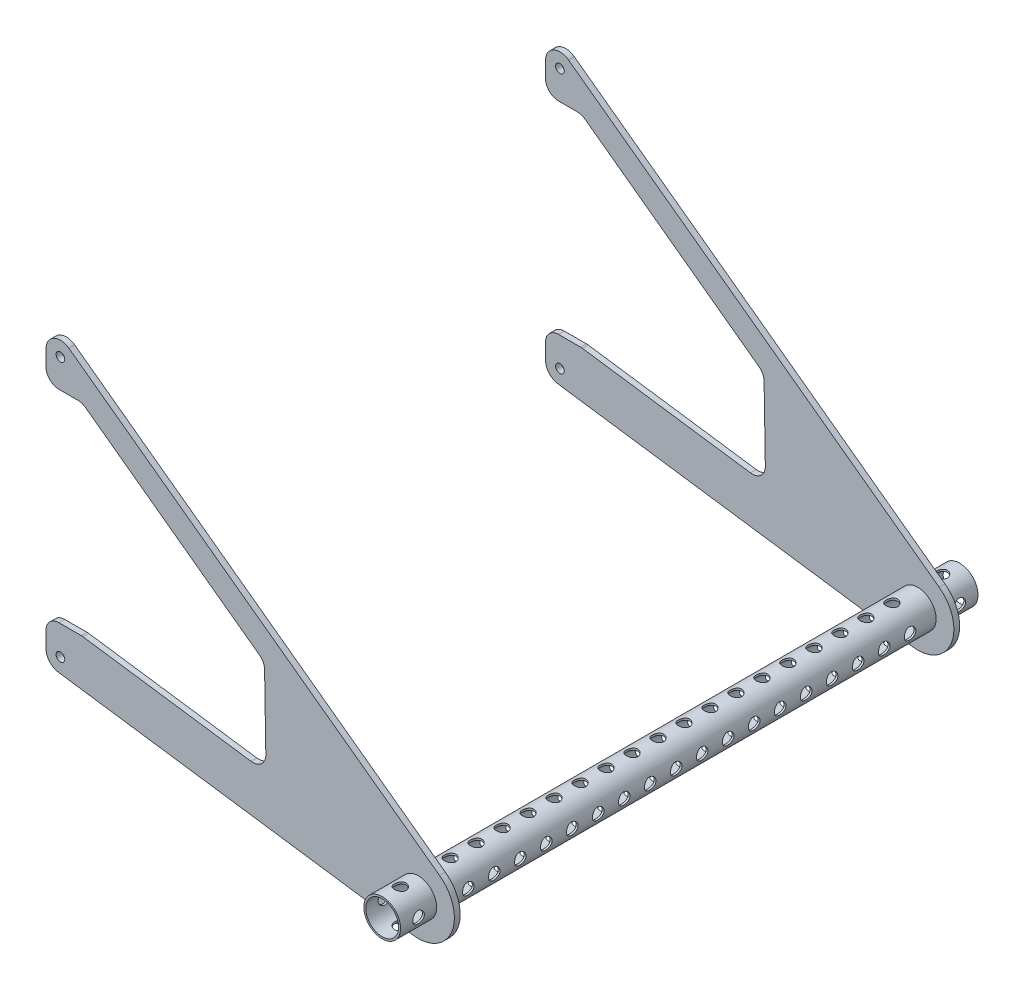
from build123d import *

# Parameters (mm, degrees)
BOSS_EXTRUDE1_DEPTH      = 200
BOSS_EXTRUDE1_DEPTH_BACK = 200
SKETCH1_R                = 12.7
SKETCH1_R_2              = 11.4
BOSS_EXTRUDE2_START      = 175
SKETCH2_R                = 3
SKETCH2_R_2              = 25
SKETCH2_R_3              = 12.7
BOSS_EXTRUDE2_DEPTH      = 4
SKETCH3_R                = 4
CUT_EXTRUDE1_DEPTH       = 389.076403758
SKETCH4_W                = 25
SKETCH4_H                = 140
CUT_EXTRUDE2_DEPTH       = 502.226790215
FILLET1_R                = 9
FILLET2_R                = 9


with BuildPart() as part:
    # Sketch1 → Boss-Extrude1 (new, two sides: drawn at the far end of the back side and taken through both)
    with BuildSketch(Plane.XY.offset(-BOSS_EXTRUDE1_DEPTH_BACK)):
        Circle(SKETCH1_R)
        Circle(SKETCH1_R_2, mode=Mode.SUBTRACT)
    extrude(amount=BOSS_EXTRUDE1_DEPTH + BOSS_EXTRUDE1_DEPTH_BACK)

    # Sketch3 → Cut-Extrude1 (cut, symmetric)
    with BuildSketch(Plane(origin=(0, 0, 0), x_dir=(1, 0, 0), z_dir=(0, 1, 0))):
        with Locations(Location((0, -187.5, 0), (0, 0, 270))):
            Circle(SKETCH3_R)
        with Locations(Location((0, -153, 0), (0, 0, 270))):
            Circle(SKETCH3_R)
        with Locations(Location((0, -135, 0), (0, 0, 270))):
            Circle(SKETCH3_R)
        with Locations(Location((0, -117, 0), (0, 0, 270))):
            Circle(SKETCH3_R)
        with Locations(Location((0, -99, 0), (0, 0, 270))):
            Circle(SKETCH3_R)
        with Locations(Location((0, -81, 0), (0, 0, 270))):
            Circle(SKETCH3_R)
        with Locations(Location((0, -63, 0), (0, 0, 270))):
            Circle(SKETCH3_R)
        with Locations(Location((0, -45, 0), (0, 0, 270))):
            Circle(SKETCH3_R)
        with Locations(Location((0, -27, 0), (0, 0, 270))):
            Circle(SKETCH3_R)
        with Locations(Location((0, -9, 0), (0, 0, 270))):
            Circle(SKETCH3_R)
    cut_extrude1 = extrude(amount=CUT_EXTRUDE1_DEPTH, both=True, mode=Mode.SUBTRACT)

    # Mirror2: Cut-Extrude1 across plane
    add(cut_extrude1.mirror(Plane.XY), mode=Mode.SUBTRACT)

    # CirPattern1: read off the stored shape, not the designer's step
    # CirPattern1: loft between two sections, ruled curve by curve
    cirpattern1_from = [
        Edge.make_three_point_arc((-12.700082991, 4, -9), (-12.700082991, 0, -5), (-12.700082991, -4, -9)),
        Edge.make_three_point_arc((-12.700082991, -4, -9), (-12.700082991, 0, -13), (-12.700082991, 4, -9)),
    ]
    cirpattern1_to = [
        Edge.make_three_point_arc((-10.674777388, 4, -9), (-10.674777388, 0, -5), (-10.674777388, -4, -9)),
        Edge.make_three_point_arc((-10.674777388, -4, -9), (-10.674777388, 0, -13), (-10.674777388, 4, -9)),
    ]
    cirpattern1 = Solid(Shell([*[Face.make_surface_from_curves(cirpattern1_from[k], cirpattern1_to[k]) for k in range(2)], Face(Wire(cirpattern1_from)), Face(Wire(cirpattern1_to))]))
    add(cirpattern1, mode=Mode.SUBTRACT)

    # CirPattern1 2: loft between two sections, ruled curve by curve
    cirpattern1_2_from = [
        Edge.make_three_point_arc((10.674895765, 0, -5), (10.674895765, -4, -9), (10.674895765, 0, -13)),
        Edge.make_three_point_arc((10.674895765, 0, -13), (10.674895765, 4, -9), (10.674895765, 0, -5)),
    ]
    cirpattern1_2_to = [
        Edge.make_three_point_arc((12.700001188, 0, -5), (12.700001188, -4, -9), (12.700001188, 0, -13)),
        Edge.make_three_point_arc((12.700001188, 0, -13), (12.700001188, 4, -9), (12.700001188, 0, -5)),
    ]
    cirpattern1_2 = Solid(Shell([*[Face.make_surface_from_curves(cirpattern1_2_from[k], cirpattern1_2_to[k]) for k in range(2)], Face(Wire(cirpattern1_2_from)), Face(Wire(cirpattern1_2_to))]))
    add(cirpattern1_2, mode=Mode.SUBTRACT)

    # CirPattern1 3: loft between two sections, ruled curve by curve
    cirpattern1_3_from = [
        Edge.make_three_point_arc((-12.700082991, 4, -27), (-12.700082991, 0, -23), (-12.700082991, -4, -27)),
        Edge.make_three_point_arc((-12.700082991, -4, -27), (-12.700082991, 0, -31), (-12.700082991, 4, -27)),
    ]
    cirpattern1_3_to = [
        Edge.make_three_point_arc((-10.674777388, 4, -27), (-10.674777388, 0, -23), (-10.674777388, -4, -27)),
        Edge.make_three_point_arc((-10.674777388, -4, -27), (-10.674777388, 0, -31), (-10.674777388, 4, -27)),
    ]
    cirpattern1_3 = Solid(Shell([*[Face.make_surface_from_curves(cirpattern1_3_from[k], cirpattern1_3_to[k]) for k in range(2)], Face(Wire(cirpattern1_3_from)), Face(Wire(cirpattern1_3_to))]))
    add(cirpattern1_3, mode=Mode.SUBTRACT)

    # CirPattern1 4: loft between two sections, ruled curve by curve
    cirpattern1_4_from = [
        Edge.make_three_point_arc((10.674895765, 0, -23), (10.674895765, -4, -27), (10.674895765, 0, -31)),
        Edge.make_three_point_arc((10.674895765, 0, -31), (10.674895765, 4, -27), (10.674895765, 0, -23)),
    ]
    cirpattern1_4_to = [
        Edge.make_three_point_arc((12.700001188, 0, -23), (12.700001188, -4, -27), (12.700001188, 0, -31)),
        Edge.make_three_point_arc((12.700001188, 0, -31), (12.700001188, 4, -27), (12.700001188, 0, -23)),
    ]
    cirpattern1_4 = Solid(Shell([*[Face.make_surface_from_curves(cirpattern1_4_from[k], cirpattern1_4_to[k]) for k in range(2)], Face(Wire(cirpattern1_4_from)), Face(Wire(cirpattern1_4_to))]))
    add(cirpattern1_4, mode=Mode.SUBTRACT)

    # CirPattern1 5: loft between two sections, ruled curve by curve
    cirpattern1_5_from = [
        Edge.make_three_point_arc((-12.700082991, 4, -45), (-12.700082991, 0, -41), (-12.700082991, -4, -45)),
        Edge.make_three_point_arc((-12.700082991, -4, -45), (-12.700082991, 0, -49), (-12.700082991, 4, -45)),
    ]
    cirpattern1_5_to = [
        Edge.make_three_point_arc((-10.674777388, 4, -45), (-10.674777388, 0, -41), (-10.674777388, -4, -45)),
        Edge.make_three_point_arc((-10.674777388, -4, -45), (-10.674777388, 0, -49), (-10.674777388, 4, -45)),
    ]
    cirpattern1_5 = Solid(Shell([*[Face.make_surface_from_curves(cirpattern1_5_from[k], cirpattern1_5_to[k]) for k in range(2)], Face(Wire(cirpattern1_5_from)), Face(Wire(cirpattern1_5_to))]))
    add(cirpattern1_5, mode=Mode.SUBTRACT)

    # CirPattern1 6: loft between two sections, ruled curve by curve
    cirpattern1_6_from = [
        Edge.make_three_point_arc((10.674895765, 0, -41), (10.674895765, -4, -45), (10.674895765, 0, -49)),
        Edge.make_three_point_arc((10.674895765, 0, -49), (10.674895765, 4, -45), (10.674895765, 0, -41)),
    ]
    cirpattern1_6_to = [
        Edge.make_three_point_arc((12.700001188, 0, -41), (12.700001188, -4, -45), (12.700001188, 0, -49)),
        Edge.make_three_point_arc((12.700001188, 0, -49), (12.700001188, 4, -45), (12.700001188, 0, -41)),
    ]
    cirpattern1_6 = Solid(Shell([*[Face.make_surface_from_curves(cirpattern1_6_from[k], cirpattern1_6_to[k]) for k in range(2)], Face(Wire(cirpattern1_6_from)), Face(Wire(cirpattern1_6_to))]))
    add(cirpattern1_6, mode=Mode.SUBTRACT)

    # CirPattern1 7: loft between two sections, ruled curve by curve
    cirpattern1_7_from = [
        Edge.make_three_point_arc((-12.700082991, 4, -63), (-12.700082991, 0, -59), (-12.700082991, -4, -63)),
        Edge.make_three_point_arc((-12.700082991, -4, -63), (-12.700082991, 0, -67), (-12.700082991, 4, -63)),
    ]
    cirpattern1_7_to = [
        Edge.make_three_point_arc((-10.674777388, 4, -63), (-10.674777388, 0, -59), (-10.674777388, -4, -63)),
        Edge.make_three_point_arc((-10.674777388, -4, -63), (-10.674777388, 0, -67), (-10.674777388, 4, -63)),
    ]
    cirpattern1_7 = Solid(Shell([*[Face.make_surface_from_curves(cirpattern1_7_from[k], cirpattern1_7_to[k]) for k in range(2)], Face(Wire(cirpattern1_7_from)), Face(Wire(cirpattern1_7_to))]))
    add(cirpattern1_7, mode=Mode.SUBTRACT)

    # CirPattern1 8: loft between two sections, ruled curve by curve
    cirpattern1_8_from = [
        Edge.make_three_point_arc((10.674895765, 0, -59), (10.674895765, -4, -63), (10.674895765, 0, -67)),
        Edge.make_three_point_arc((10.674895765, 0, -67), (10.674895765, 4, -63), (10.674895765, 0, -59)),
    ]
    cirpattern1_8_to = [
        Edge.make_three_point_arc((12.700001188, 0, -59), (12.700001188, -4, -63), (12.700001188, 0, -67)),
        Edge.make_three_point_arc((12.700001188, 0, -67), (12.700001188, 4, -63), (12.700001188, 0, -59)),
    ]
    cirpattern1_8 = Solid(Shell([*[Face.make_surface_from_curves(cirpattern1_8_from[k], cirpattern1_8_to[k]) for k in range(2)], Face(Wire(cirpattern1_8_from)), Face(Wire(cirpattern1_8_to))]))
    add(cirpattern1_8, mode=Mode.SUBTRACT)

    # CirPattern1 9: loft between two sections, ruled curve by curve
    cirpattern1_9_from = [
        Edge.make_three_point_arc((-12.700082991, 4, -81), (-12.700082991, 0, -77), (-12.700082991, -4, -81)),
        Edge.make_three_point_arc((-12.700082991, -4, -81), (-12.700082991, 0, -85), (-12.700082991, 4, -81)),
    ]
    cirpattern1_9_to = [
        Edge.make_three_point_arc((-10.674777388, 4, -81), (-10.674777388, 0, -77), (-10.674777388, -4, -81)),
        Edge.make_three_point_arc((-10.674777388, -4, -81), (-10.674777388, 0, -85), (-10.674777388, 4, -81)),
    ]
    cirpattern1_9 = Solid(Shell([*[Face.make_surface_from_curves(cirpattern1_9_from[k], cirpattern1_9_to[k]) for k in range(2)], Face(Wire(cirpattern1_9_from)), Face(Wire(cirpattern1_9_to))]))
    add(cirpattern1_9, mode=Mode.SUBTRACT)

    # CirPattern1 10: loft between two sections, ruled curve by curve
    cirpattern1_10_from = [
        Edge.make_three_point_arc((10.674895765, 0, -77), (10.674895765, -4, -81), (10.674895765, 0, -85)),
        Edge.make_three_point_arc((10.674895765, 0, -85), (10.674895765, 4, -81), (10.674895765, 0, -77)),
    ]
    cirpattern1_10_to = [
        Edge.make_three_point_arc((12.700001188, 0, -77), (12.700001188, -4, -81), (12.700001188, 0, -85)),
        Edge.make_three_point_arc((12.700001188, 0, -85), (12.700001188, 4, -81), (12.700001188, 0, -77)),
    ]
    cirpattern1_10 = Solid(Shell([*[Face.make_surface_from_curves(cirpattern1_10_from[k], cirpattern1_10_to[k]) for k in range(2)], Face(Wire(cirpattern1_10_from)), Face(Wire(cirpattern1_10_to))]))
    add(cirpattern1_10, mode=Mode.SUBTRACT)

    # CirPattern1 11: loft between two sections, ruled curve by curve
    cirpattern1_11_from = [
        Edge.make_three_point_arc((-12.700082991, 4, -99), (-12.700082991, 0, -95), (-12.700082991, -4, -99)),
        Edge.make_three_point_arc((-12.700082991, -4, -99), (-12.700082991, 0, -103), (-12.700082991, 4, -99)),
    ]
    cirpattern1_11_to = [
        Edge.make_three_point_arc((-10.674777388, 4, -99), (-10.674777388, 0, -95), (-10.674777388, -4, -99)),
        Edge.make_three_point_arc((-10.674777388, -4, -99), (-10.674777388, 0, -103), (-10.674777388, 4, -99)),
    ]
    cirpattern1_11 = Solid(Shell([*[Face.make_surface_from_curves(cirpattern1_11_from[k], cirpattern1_11_to[k]) for k in range(2)], Face(Wire(cirpattern1_11_from)), Face(Wire(cirpattern1_11_to))]))
    add(cirpattern1_11, mode=Mode.SUBTRACT)

    # CirPattern1 12: loft between two sections, ruled curve by curve
    cirpattern1_12_from = [
        Edge.make_three_point_arc((10.674895765, 0, -95), (10.674895765, -4, -99), (10.674895765, 0, -103)),
        Edge.make_three_point_arc((10.674895765, 0, -103), (10.674895765, 4, -99), (10.674895765, 0, -95)),
    ]
    cirpattern1_12_to = [
        Edge.make_three_point_arc((12.700001188, 0, -95), (12.700001188, -4, -99), (12.700001188, 0, -103)),
        Edge.make_three_point_arc((12.700001188, 0, -103), (12.700001188, 4, -99), (12.700001188, 0, -95)),
    ]
    cirpattern1_12 = Solid(Shell([*[Face.make_surface_from_curves(cirpattern1_12_from[k], cirpattern1_12_to[k]) for k in range(2)], Face(Wire(cirpattern1_12_from)), Face(Wire(cirpattern1_12_to))]))
    add(cirpattern1_12, mode=Mode.SUBTRACT)

    # CirPattern1 13: loft between two sections, ruled curve by curve
    cirpattern1_13_from = [
        Edge.make_three_point_arc((-12.700082991, 4, -117), (-12.700082991, 0, -113), (-12.700082991, -4, -117)),
        Edge.make_three_point_arc((-12.700082991, -4, -117), (-12.700082991, 0, -121), (-12.700082991, 4, -117)),
    ]
    cirpattern1_13_to = [
        Edge.make_three_point_arc((-10.674777388, 4, -117), (-10.674777388, 0, -113), (-10.674777388, -4, -117)),
        Edge.make_three_point_arc((-10.674777388, -4, -117), (-10.674777388, 0, -121), (-10.674777388, 4, -117)),
    ]
    cirpattern1_13 = Solid(Shell([*[Face.make_surface_from_curves(cirpattern1_13_from[k], cirpattern1_13_to[k]) for k in range(2)], Face(Wire(cirpattern1_13_from)), Face(Wire(cirpattern1_13_to))]))
    add(cirpattern1_13, mode=Mode.SUBTRACT)

    # CirPattern1 14: loft between two sections, ruled curve by curve
    cirpattern1_14_from = [
        Edge.make_three_point_arc((10.674895765, 0, -113), (10.674895765, -4, -117), (10.674895765, 0, -121)),
        Edge.make_three_point_arc((10.674895765, 0, -121), (10.674895765, 4, -117), (10.674895765, 0, -113)),
    ]
    cirpattern1_14_to = [
        Edge.make_three_point_arc((12.700001188, 0, -113), (12.700001188, -4, -117), (12.700001188, 0, -121)),
        Edge.make_three_point_arc((12.700001188, 0, -121), (12.700001188, 4, -117), (12.700001188, 0, -113)),
    ]
    cirpattern1_14 = Solid(Shell([*[Face.make_surface_from_curves(cirpattern1_14_from[k], cirpattern1_14_to[k]) for k in range(2)], Face(Wire(cirpattern1_14_from)), Face(Wire(cirpattern1_14_to))]))
    add(cirpattern1_14, mode=Mode.SUBTRACT)

    # CirPattern1 15: loft between two sections, ruled curve by curve
    cirpattern1_15_from = [
        Edge.make_three_point_arc((-12.700082991, 4, -135), (-12.700082991, 0, -131), (-12.700082991, -4, -135)),
        Edge.make_three_point_arc((-12.700082991, -4, -135), (-12.700082991, 0, -139), (-12.700082991, 4, -135)),
    ]
    cirpattern1_15_to = [
        Edge.make_three_point_arc((-10.674777388, 4, -135), (-10.674777388, 0, -131), (-10.674777388, -4, -135)),
        Edge.make_three_point_arc((-10.674777388, -4, -135), (-10.674777388, 0, -139), (-10.674777388, 4, -135)),
    ]
    cirpattern1_15 = Solid(Shell([*[Face.make_surface_from_curves(cirpattern1_15_from[k], cirpattern1_15_to[k]) for k in range(2)], Face(Wire(cirpattern1_15_from)), Face(Wire(cirpattern1_15_to))]))
    add(cirpattern1_15, mode=Mode.SUBTRACT)

    # CirPattern1 16: loft between two sections, ruled curve by curve
    cirpattern1_16_from = [
        Edge.make_three_point_arc((10.674895765, 0, -131), (10.674895765, -4, -135), (10.674895765, 0, -139)),
        Edge.make_three_point_arc((10.674895765, 0, -139), (10.674895765, 4, -135), (10.674895765, 0, -131)),
    ]
    cirpattern1_16_to = [
        Edge.make_three_point_arc((12.700001188, 0, -131), (12.700001188, -4, -135), (12.700001188, 0, -139)),
        Edge.make_three_point_arc((12.700001188, 0, -139), (12.700001188, 4, -135), (12.700001188, 0, -131)),
    ]
    cirpattern1_16 = Solid(Shell([*[Face.make_surface_from_curves(cirpattern1_16_from[k], cirpattern1_16_to[k]) for k in range(2)], Face(Wire(cirpattern1_16_from)), Face(Wire(cirpattern1_16_to))]))
    add(cirpattern1_16, mode=Mode.SUBTRACT)

    # CirPattern1 17: loft between two sections, ruled curve by curve
    cirpattern1_17_from = [
        Edge.make_three_point_arc((-12.700082991, 4, -153), (-12.700082991, 0, -149), (-12.700082991, -4, -153)),
        Edge.make_three_point_arc((-12.700082991, -4, -153), (-12.700082991, 0, -157), (-12.700082991, 4, -153)),
    ]
    cirpattern1_17_to = [
        Edge.make_three_point_arc((-10.674777388, 4, -153), (-10.674777388, 0, -149), (-10.674777388, -4, -153)),
        Edge.make_three_point_arc((-10.674777388, -4, -153), (-10.674777388, 0, -157), (-10.674777388, 4, -153)),
    ]
    cirpattern1_17 = Solid(Shell([*[Face.make_surface_from_curves(cirpattern1_17_from[k], cirpattern1_17_to[k]) for k in range(2)], Face(Wire(cirpattern1_17_from)), Face(Wire(cirpattern1_17_to))]))
    add(cirpattern1_17, mode=Mode.SUBTRACT)

    # CirPattern1 18: loft between two sections, ruled curve by curve
    cirpattern1_18_from = [
        Edge.make_three_point_arc((10.674895765, 0, -149), (10.674895765, -4, -153), (10.674895765, 0, -157)),
        Edge.make_three_point_arc((10.674895765, 0, -157), (10.674895765, 4, -153), (10.674895765, 0, -149)),
    ]
    cirpattern1_18_to = [
        Edge.make_three_point_arc((12.700001188, 0, -149), (12.700001188, -4, -153), (12.700001188, 0, -157)),
        Edge.make_three_point_arc((12.700001188, 0, -157), (12.700001188, 4, -153), (12.700001188, 0, -149)),
    ]
    cirpattern1_18 = Solid(Shell([*[Face.make_surface_from_curves(cirpattern1_18_from[k], cirpattern1_18_to[k]) for k in range(2)], Face(Wire(cirpattern1_18_from)), Face(Wire(cirpattern1_18_to))]))
    add(cirpattern1_18, mode=Mode.SUBTRACT)

    # CirPattern1 19: loft between two sections, ruled curve by curve
    cirpattern1_19_from = [
        Edge.make_three_point_arc((-12.700082991, 4, -187.5), (-12.700082991, 0, -183.5), (-12.700082991, -4, -187.5)),
        Edge.make_three_point_arc((-12.700082991, -4, -187.5), (-12.700082991, 0, -191.5), (-12.700082991, 4, -187.5)),
    ]
    cirpattern1_19_to = [
        Edge.make_three_point_arc((-10.674777388, 4, -187.5), (-10.674777388, 0, -183.5), (-10.674777388, -4, -187.5)),
        Edge.make_three_point_arc((-10.674777388, -4, -187.5), (-10.674777388, 0, -191.5), (-10.674777388, 4, -187.5)),
    ]
    cirpattern1_19 = Solid(Shell([*[Face.make_surface_from_curves(cirpattern1_19_from[k], cirpattern1_19_to[k]) for k in range(2)], Face(Wire(cirpattern1_19_from)), Face(Wire(cirpattern1_19_to))]))
    add(cirpattern1_19, mode=Mode.SUBTRACT)

    # CirPattern1 20: loft between two sections, ruled curve by curve
    cirpattern1_20_from = [
        Edge.make_three_point_arc((10.674895765, 0, -183.5), (10.674895765, -4, -187.5), (10.674895765, 0, -191.5)),
        Edge.make_three_point_arc((10.674895765, 0, -191.5), (10.674895765, 4, -187.5), (10.674895765, 0, -183.5)),
    ]
    cirpattern1_20_to = [
        Edge.make_three_point_arc((12.700001188, 0, -183.5), (12.700001188, -4, -187.5), (12.700001188, 0, -191.5)),
        Edge.make_three_point_arc((12.700001188, 0, -191.5), (12.700001188, 4, -187.5), (12.700001188, 0, -183.5)),
    ]
    cirpattern1_20 = Solid(Shell([*[Face.make_surface_from_curves(cirpattern1_20_from[k], cirpattern1_20_to[k]) for k in range(2)], Face(Wire(cirpattern1_20_from)), Face(Wire(cirpattern1_20_to))]))
    add(cirpattern1_20, mode=Mode.SUBTRACT)

    # CirPattern1 21: loft between two sections, ruled curve by curve
    cirpattern1_21_from = [
        Edge.make_three_point_arc((10.674895765, 0, 183.5), (10.674895765, 4, 187.5), (10.674895765, 0, 191.5)),
        Edge.make_three_point_arc((10.674895765, 0, 191.5), (10.674895765, -4, 187.5), (10.674895765, 0, 183.5)),
    ]
    cirpattern1_21_to = [
        Edge.make_three_point_arc((12.700001188, 0, 183.5), (12.700001188, 4, 187.5), (12.700001188, 0, 191.5)),
        Edge.make_three_point_arc((12.700001188, 0, 191.5), (12.700001188, -4, 187.5), (12.700001188, 0, 183.5)),
    ]
    cirpattern1_21 = Solid(Shell([*[Face.make_surface_from_curves(cirpattern1_21_from[k], cirpattern1_21_to[k]) for k in range(2)], Face(Wire(cirpattern1_21_from)), Face(Wire(cirpattern1_21_to))]))
    add(cirpattern1_21, mode=Mode.SUBTRACT)

    # CirPattern1 22: loft between two sections, ruled curve by curve
    cirpattern1_22_from = [
        Edge.make_three_point_arc((-12.700356377, 4, 187.5), (-12.700356377, 0, 191.5), (-12.700356377, -4, 187.5)),
        Edge.make_three_point_arc((-12.700356377, -4, 187.5), (-12.700356377, 0, 183.5), (-12.700356377, 4, 187.5)),
    ]
    cirpattern1_22_to = [
        Edge.make_three_point_arc((-10.674777388, 4, 187.5), (-10.674777388, 0, 191.5), (-10.674777388, -4, 187.5)),
        Edge.make_three_point_arc((-10.674777388, -4, 187.5), (-10.674777388, 0, 183.5), (-10.674777388, 4, 187.5)),
    ]
    cirpattern1_22 = Solid(Shell([*[Face.make_surface_from_curves(cirpattern1_22_from[k], cirpattern1_22_to[k]) for k in range(2)], Face(Wire(cirpattern1_22_from)), Face(Wire(cirpattern1_22_to))]))
    add(cirpattern1_22, mode=Mode.SUBTRACT)

    # CirPattern1 23: loft between two sections, ruled curve by curve
    cirpattern1_23_from = [
        Edge.make_three_point_arc((10.674895765, 0, 149), (10.674895765, 4, 153), (10.674895765, 0, 157)),
        Edge.make_three_point_arc((10.674895765, 0, 157), (10.674895765, -4, 153), (10.674895765, 0, 149)),
    ]
    cirpattern1_23_to = [
        Edge.make_three_point_arc((12.700001188, 0, 149), (12.700001188, 4, 153), (12.700001188, 0, 157)),
        Edge.make_three_point_arc((12.700001188, 0, 157), (12.700001188, -4, 153), (12.700001188, 0, 149)),
    ]
    cirpattern1_23 = Solid(Shell([*[Face.make_surface_from_curves(cirpattern1_23_from[k], cirpattern1_23_to[k]) for k in range(2)], Face(Wire(cirpattern1_23_from)), Face(Wire(cirpattern1_23_to))]))
    add(cirpattern1_23, mode=Mode.SUBTRACT)

    # CirPattern1 24: loft between two sections, ruled curve by curve
    cirpattern1_24_from = [
        Edge.make_three_point_arc((-12.700356377, 4, 153), (-12.700356377, 0, 157), (-12.700356377, -4, 153)),
        Edge.make_three_point_arc((-12.700356377, -4, 153), (-12.700356377, 0, 149), (-12.700356377, 4, 153)),
    ]
    cirpattern1_24_to = [
        Edge.make_three_point_arc((-10.674777388, 4, 153), (-10.674777388, 0, 157), (-10.674777388, -4, 153)),
        Edge.make_three_point_arc((-10.674777388, -4, 153), (-10.674777388, 0, 149), (-10.674777388, 4, 153)),
    ]
    cirpattern1_24 = Solid(Shell([*[Face.make_surface_from_curves(cirpattern1_24_from[k], cirpattern1_24_to[k]) for k in range(2)], Face(Wire(cirpattern1_24_from)), Face(Wire(cirpattern1_24_to))]))
    add(cirpattern1_24, mode=Mode.SUBTRACT)

    # CirPattern1 25: loft between two sections, ruled curve by curve
    cirpattern1_25_from = [
        Edge.make_three_point_arc((10.674895765, 0, 131), (10.674895765, 4, 135), (10.674895765, 0, 139)),
        Edge.make_three_point_arc((10.674895765, 0, 139), (10.674895765, -4, 135), (10.674895765, 0, 131)),
    ]
    cirpattern1_25_to = [
        Edge.make_three_point_arc((12.700001188, 0, 131), (12.700001188, 4, 135), (12.700001188, 0, 139)),
        Edge.make_three_point_arc((12.700001188, 0, 139), (12.700001188, -4, 135), (12.700001188, 0, 131)),
    ]
    cirpattern1_25 = Solid(Shell([*[Face.make_surface_from_curves(cirpattern1_25_from[k], cirpattern1_25_to[k]) for k in range(2)], Face(Wire(cirpattern1_25_from)), Face(Wire(cirpattern1_25_to))]))
    add(cirpattern1_25, mode=Mode.SUBTRACT)

    # CirPattern1 26: loft between two sections, ruled curve by curve
    cirpattern1_26_from = [
        Edge.make_three_point_arc((-12.700356377, 4, 135), (-12.700356377, 0, 139), (-12.700356377, -4, 135)),
        Edge.make_three_point_arc((-12.700356377, -4, 135), (-12.700356377, 0, 131), (-12.700356377, 4, 135)),
    ]
    cirpattern1_26_to = [
        Edge.make_three_point_arc((-10.674777388, 4, 135), (-10.674777388, 0, 139), (-10.674777388, -4, 135)),
        Edge.make_three_point_arc((-10.674777388, -4, 135), (-10.674777388, 0, 131), (-10.674777388, 4, 135)),
    ]
    cirpattern1_26 = Solid(Shell([*[Face.make_surface_from_curves(cirpattern1_26_from[k], cirpattern1_26_to[k]) for k in range(2)], Face(Wire(cirpattern1_26_from)), Face(Wire(cirpattern1_26_to))]))
    add(cirpattern1_26, mode=Mode.SUBTRACT)

    # CirPattern1 27: loft between two sections, ruled curve by curve
    cirpattern1_27_from = [
        Edge.make_three_point_arc((10.674895765, 0, 113), (10.674895765, 4, 117), (10.674895765, 0, 121)),
        Edge.make_three_point_arc((10.674895765, 0, 121), (10.674895765, -4, 117), (10.674895765, 0, 113)),
    ]
    cirpattern1_27_to = [
        Edge.make_three_point_arc((12.700001188, 0, 113), (12.700001188, 4, 117), (12.700001188, 0, 121)),
        Edge.make_three_point_arc((12.700001188, 0, 121), (12.700001188, -4, 117), (12.700001188, 0, 113)),
    ]
    cirpattern1_27 = Solid(Shell([*[Face.make_surface_from_curves(cirpattern1_27_from[k], cirpattern1_27_to[k]) for k in range(2)], Face(Wire(cirpattern1_27_from)), Face(Wire(cirpattern1_27_to))]))
    add(cirpattern1_27, mode=Mode.SUBTRACT)

    # CirPattern1 28: loft between two sections, ruled curve by curve
    cirpattern1_28_from = [
        Edge.make_three_point_arc((-12.700356377, 4, 117), (-12.700356377, 0, 121), (-12.700356377, -4, 117)),
        Edge.make_three_point_arc((-12.700356377, -4, 117), (-12.700356377, 0, 113), (-12.700356377, 4, 117)),
    ]
    cirpattern1_28_to = [
        Edge.make_three_point_arc((-10.674777388, 4, 117), (-10.674777388, 0, 121), (-10.674777388, -4, 117)),
        Edge.make_three_point_arc((-10.674777388, -4, 117), (-10.674777388, 0, 113), (-10.674777388, 4, 117)),
    ]
    cirpattern1_28 = Solid(Shell([*[Face.make_surface_from_curves(cirpattern1_28_from[k], cirpattern1_28_to[k]) for k in range(2)], Face(Wire(cirpattern1_28_from)), Face(Wire(cirpattern1_28_to))]))
    add(cirpattern1_28, mode=Mode.SUBTRACT)

    # CirPattern1 29: loft between two sections, ruled curve by curve
    cirpattern1_29_from = [
        Edge.make_three_point_arc((10.674895765, 0, 95), (10.674895765, 4, 99), (10.674895765, 0, 103)),
        Edge.make_three_point_arc((10.674895765, 0, 103), (10.674895765, -4, 99), (10.674895765, 0, 95)),
    ]
    cirpattern1_29_to = [
        Edge.make_three_point_arc((12.700001188, 0, 95), (12.700001188, 4, 99), (12.700001188, 0, 103)),
        Edge.make_three_point_arc((12.700001188, 0, 103), (12.700001188, -4, 99), (12.700001188, 0, 95)),
    ]
    cirpattern1_29 = Solid(Shell([*[Face.make_surface_from_curves(cirpattern1_29_from[k], cirpattern1_29_to[k]) for k in range(2)], Face(Wire(cirpattern1_29_from)), Face(Wire(cirpattern1_29_to))]))
    add(cirpattern1_29, mode=Mode.SUBTRACT)

    # CirPattern1 30: loft between two sections, ruled curve by curve
    cirpattern1_30_from = [
        Edge.make_three_point_arc((-12.700356377, 4, 99), (-12.700356377, 0, 103), (-12.700356377, -4, 99)),
        Edge.make_three_point_arc((-12.700356377, -4, 99), (-12.700356377, 0, 95), (-12.700356377, 4, 99)),
    ]
    cirpattern1_30_to = [
        Edge.make_three_point_arc((-10.674777388, 4, 99), (-10.674777388, 0, 103), (-10.674777388, -4, 99)),
        Edge.make_three_point_arc((-10.674777388, -4, 99), (-10.674777388, 0, 95), (-10.674777388, 4, 99)),
    ]
    cirpattern1_30 = Solid(Shell([*[Face.make_surface_from_curves(cirpattern1_30_from[k], cirpattern1_30_to[k]) for k in range(2)], Face(Wire(cirpattern1_30_from)), Face(Wire(cirpattern1_30_to))]))
    add(cirpattern1_30, mode=Mode.SUBTRACT)

    # CirPattern1 31: loft between two sections, ruled curve by curve
    cirpattern1_31_from = [
        Edge.make_three_point_arc((10.674895765, 0, 77), (10.674895765, 4, 81), (10.674895765, 0, 85)),
        Edge.make_three_point_arc((10.674895765, 0, 85), (10.674895765, -4, 81), (10.674895765, 0, 77)),
    ]
    cirpattern1_31_to = [
        Edge.make_three_point_arc((12.700001188, 0, 77), (12.700001188, 4, 81), (12.700001188, 0, 85)),
        Edge.make_three_point_arc((12.700001188, 0, 85), (12.700001188, -4, 81), (12.700001188, 0, 77)),
    ]
    cirpattern1_31 = Solid(Shell([*[Face.make_surface_from_curves(cirpattern1_31_from[k], cirpattern1_31_to[k]) for k in range(2)], Face(Wire(cirpattern1_31_from)), Face(Wire(cirpattern1_31_to))]))
    add(cirpattern1_31, mode=Mode.SUBTRACT)

    # CirPattern1 32: loft between two sections, ruled curve by curve
    cirpattern1_32_from = [
        Edge.make_three_point_arc((-12.700356377, 4, 81), (-12.700356377, 0, 85), (-12.700356377, -4, 81)),
        Edge.make_three_point_arc((-12.700356377, -4, 81), (-12.700356377, 0, 77), (-12.700356377, 4, 81)),
    ]
    cirpattern1_32_to = [
        Edge.make_three_point_arc((-10.674777388, 4, 81), (-10.674777388, 0, 85), (-10.674777388, -4, 81)),
        Edge.make_three_point_arc((-10.674777388, -4, 81), (-10.674777388, 0, 77), (-10.674777388, 4, 81)),
    ]
    cirpattern1_32 = Solid(Shell([*[Face.make_surface_from_curves(cirpattern1_32_from[k], cirpattern1_32_to[k]) for k in range(2)], Face(Wire(cirpattern1_32_from)), Face(Wire(cirpattern1_32_to))]))
    add(cirpattern1_32, mode=Mode.SUBTRACT)

    # CirPattern1 33: loft between two sections, ruled curve by curve
    cirpattern1_33_from = [
        Edge.make_three_point_arc((10.674895765, 0, 59), (10.674895765, 4, 63), (10.674895765, 0, 67)),
        Edge.make_three_point_arc((10.674895765, 0, 67), (10.674895765, -4, 63), (10.674895765, 0, 59)),
    ]
    cirpattern1_33_to = [
        Edge.make_three_point_arc((12.700001188, 0, 59), (12.700001188, 4, 63), (12.700001188, 0, 67)),
        Edge.make_three_point_arc((12.700001188, 0, 67), (12.700001188, -4, 63), (12.700001188, 0, 59)),
    ]
    cirpattern1_33 = Solid(Shell([*[Face.make_surface_from_curves(cirpattern1_33_from[k], cirpattern1_33_to[k]) for k in range(2)], Face(Wire(cirpattern1_33_from)), Face(Wire(cirpattern1_33_to))]))
    add(cirpattern1_33, mode=Mode.SUBTRACT)

    # CirPattern1 34: loft between two sections, ruled curve by curve
    cirpattern1_34_from = [
        Edge.make_three_point_arc((-12.700356377, 4, 63), (-12.700356377, 0, 67), (-12.700356377, -4, 63)),
        Edge.make_three_point_arc((-12.700356377, -4, 63), (-12.700356377, 0, 59), (-12.700356377, 4, 63)),
    ]
    cirpattern1_34_to = [
        Edge.make_three_point_arc((-10.674777388, 4, 63), (-10.674777388, 0, 67), (-10.674777388, -4, 63)),
        Edge.make_three_point_arc((-10.674777388, -4, 63), (-10.674777388, 0, 59), (-10.674777388, 4, 63)),
    ]
    cirpattern1_34 = Solid(Shell([*[Face.make_surface_from_curves(cirpattern1_34_from[k], cirpattern1_34_to[k]) for k in range(2)], Face(Wire(cirpattern1_34_from)), Face(Wire(cirpattern1_34_to))]))
    add(cirpattern1_34, mode=Mode.SUBTRACT)

    # CirPattern1 35: loft between two sections, ruled curve by curve
    cirpattern1_35_from = [
        Edge.make_three_point_arc((10.674895765, 0, 41), (10.674895765, 4, 45), (10.674895765, 0, 49)),
        Edge.make_three_point_arc((10.674895765, 0, 49), (10.674895765, -4, 45), (10.674895765, 0, 41)),
    ]
    cirpattern1_35_to = [
        Edge.make_three_point_arc((12.700001188, 0, 41), (12.700001188, 4, 45), (12.700001188, 0, 49)),
        Edge.make_three_point_arc((12.700001188, 0, 49), (12.700001188, -4, 45), (12.700001188, 0, 41)),
    ]
    cirpattern1_35 = Solid(Shell([*[Face.make_surface_from_curves(cirpattern1_35_from[k], cirpattern1_35_to[k]) for k in range(2)], Face(Wire(cirpattern1_35_from)), Face(Wire(cirpattern1_35_to))]))
    add(cirpattern1_35, mode=Mode.SUBTRACT)

    # CirPattern1 36: loft between two sections, ruled curve by curve
    cirpattern1_36_from = [
        Edge.make_three_point_arc((-12.700356377, 4, 45), (-12.700356377, 0, 49), (-12.700356377, -4, 45)),
        Edge.make_three_point_arc((-12.700356377, -4, 45), (-12.700356377, 0, 41), (-12.700356377, 4, 45)),
    ]
    cirpattern1_36_to = [
        Edge.make_three_point_arc((-10.674777388, 4, 45), (-10.674777388, 0, 49), (-10.674777388, -4, 45)),
        Edge.make_three_point_arc((-10.674777388, -4, 45), (-10.674777388, 0, 41), (-10.674777388, 4, 45)),
    ]
    cirpattern1_36 = Solid(Shell([*[Face.make_surface_from_curves(cirpattern1_36_from[k], cirpattern1_36_to[k]) for k in range(2)], Face(Wire(cirpattern1_36_from)), Face(Wire(cirpattern1_36_to))]))
    add(cirpattern1_36, mode=Mode.SUBTRACT)

    # CirPattern1 37: loft between two sections, ruled curve by curve
    cirpattern1_37_from = [
        Edge.make_three_point_arc((10.674895765, 0, 23), (10.674895765, 4, 27), (10.674895765, 0, 31)),
        Edge.make_three_point_arc((10.674895765, 0, 31), (10.674895765, -4, 27), (10.674895765, 0, 23)),
    ]
    cirpattern1_37_to = [
        Edge.make_three_point_arc((12.700001188, 0, 23), (12.700001188, 4, 27), (12.700001188, 0, 31)),
        Edge.make_three_point_arc((12.700001188, 0, 31), (12.700001188, -4, 27), (12.700001188, 0, 23)),
    ]
    cirpattern1_37 = Solid(Shell([*[Face.make_surface_from_curves(cirpattern1_37_from[k], cirpattern1_37_to[k]) for k in range(2)], Face(Wire(cirpattern1_37_from)), Face(Wire(cirpattern1_37_to))]))
    add(cirpattern1_37, mode=Mode.SUBTRACT)

    # CirPattern1 38: loft between two sections, ruled curve by curve
    cirpattern1_38_from = [
        Edge.make_three_point_arc((-12.700356377, 4, 27), (-12.700356377, 0, 31), (-12.700356377, -4, 27)),
        Edge.make_three_point_arc((-12.700356377, -4, 27), (-12.700356377, 0, 23), (-12.700356377, 4, 27)),
    ]
    cirpattern1_38_to = [
        Edge.make_three_point_arc((-10.674777388, 4, 27), (-10.674777388, 0, 31), (-10.674777388, -4, 27)),
        Edge.make_three_point_arc((-10.674777388, -4, 27), (-10.674777388, 0, 23), (-10.674777388, 4, 27)),
    ]
    cirpattern1_38 = Solid(Shell([*[Face.make_surface_from_curves(cirpattern1_38_from[k], cirpattern1_38_to[k]) for k in range(2)], Face(Wire(cirpattern1_38_from)), Face(Wire(cirpattern1_38_to))]))
    add(cirpattern1_38, mode=Mode.SUBTRACT)

    # CirPattern1 39: loft between two sections, ruled curve by curve
    cirpattern1_39_from = [
        Edge.make_three_point_arc((10.674895765, 0, 5), (10.674895765, 4, 9), (10.674895765, 0, 13)),
        Edge.make_three_point_arc((10.674895765, 0, 13), (10.674895765, -4, 9), (10.674895765, 0, 5)),
    ]
    cirpattern1_39_to = [
        Edge.make_three_point_arc((12.700001188, 0, 5), (12.700001188, 4, 9), (12.700001188, 0, 13)),
        Edge.make_three_point_arc((12.700001188, 0, 13), (12.700001188, -4, 9), (12.700001188, 0, 5)),
    ]
    cirpattern1_39 = Solid(Shell([*[Face.make_surface_from_curves(cirpattern1_39_from[k], cirpattern1_39_to[k]) for k in range(2)], Face(Wire(cirpattern1_39_from)), Face(Wire(cirpattern1_39_to))]))
    add(cirpattern1_39, mode=Mode.SUBTRACT)

    # CirPattern1 40: loft between two sections, ruled curve by curve
    cirpattern1_40_from = [
        Edge.make_three_point_arc((-12.700356377, 4, 9), (-12.700356377, 0, 13), (-12.700356377, -4, 9)),
        Edge.make_three_point_arc((-12.700356377, -4, 9), (-12.700356377, 0, 5), (-12.700356377, 4, 9)),
    ]
    cirpattern1_40_to = [
        Edge.make_three_point_arc((-10.674777388, 4, 9), (-10.674777388, 0, 13), (-10.674777388, -4, 9)),
        Edge.make_three_point_arc((-10.674777388, -4, 9), (-10.674777388, 0, 5), (-10.674777388, 4, 9)),
    ]
    cirpattern1_40 = Solid(Shell([*[Face.make_surface_from_curves(cirpattern1_40_from[k], cirpattern1_40_to[k]) for k in range(2)], Face(Wire(cirpattern1_40_from)), Face(Wire(cirpattern1_40_to))]))
    add(cirpattern1_40, mode=Mode.SUBTRACT)


with BuildPart() as body_2:
    # Sketch2 → Boss-Extrude2 (new body)
    # profile 1 of 2: a face of its own
    with BuildSketch(Plane.XY.offset(BOSS_EXTRUDE2_START)):
        with BuildLine():
            ThreePointArc((-3.509922066, -24.752382655), (-23.157527065, 9.419604037), (14.764593477, 20.174409024))
            Line((14.764593477, 20.174409024), (-241.976490724, 208.06976361))
            ThreePointArc((-241.976490724, 208.06976361), (-252.406796376, 208.917913823), (-257.882328115, 200))
            Line((-257.882328115, 200), (-257.882328115, 20))
            ThreePointArc((-257.882328115, 20), (-255.433476645, 13.444074751), (-249.286296941, 10.099046938))
            Line((-249.286296941, 10.099046938), (-3.509922066, -24.752382655))
        make_face()
        with Locations((-247.882328115, 20)):
            Circle(SKETCH2_R, mode=Mode.SUBTRACT)
        with Locations((-247.882328115, 200)):
            Circle(SKETCH2_R, mode=Mode.SUBTRACT)
    # profile 2 of 2: a face of its own
    with BuildSketch(Plane.XY.offset(BOSS_EXTRUDE2_START)):
        Circle(SKETCH2_R_2)
        Circle(SKETCH2_R_3, mode=Mode.SUBTRACT)
    extrude(amount=-BOSS_EXTRUDE2_DEPTH)


with BuildPart() as body_3:
    # Mirror1: mirrored copy
    add(body_2.part.mirror(Plane.XY))


with BuildPart() as cut_extrude2_tool:
    # Sketch4 → Cut-Extrude2 (new, through all)
    with BuildSketch(Plane.XY.offset(175)):
        with Locations((-270.382328115, 110)):
            Rectangle(SKETCH4_W, SKETCH4_H)
        with Locations((-245.382328115, 110)):
            Rectangle(SKETCH4_W, SKETCH4_H)
        Polygon((-105.432122121, 21.927384668), (-232.882328115, 40), (-232.882328115, 180), (-106.550969674, 87.54469444), align=None)
    extrude(amount=-CUT_EXTRUDE2_DEPTH)


with BuildPart() as body_2_1:
    add(body_2.part)

    # Cut-Extrude2: cut by cut_extrude2_tool
    add(cut_extrude2_tool.part, mode=Mode.SUBTRACT)

    # Fillet1
    fillet1_edges = [body_2_1.edges().sort_by_distance(p)[0] for p in [
        (-257.882328115, 180, 173),
        (-232.882328115, 180, 173),
        (-106.550969674, 87.54469444, 173),
        (-105.432122121, 21.927384668, 173),
        (-257.882328115, 40, 173),
        (-232.882328115, 40, 173),
    ]]
    fillet(fillet1_edges, radius=FILLET1_R)


with BuildPart() as body_3_1:
    add(body_3.part)

    # Cut-Extrude2: cut by cut_extrude2_tool
    add(cut_extrude2_tool.part, mode=Mode.SUBTRACT)

    # Fillet2
    fillet2_edges = [body_3_1.edges().sort_by_distance(p)[0] for p in [
        (-232.882328115, 180, -173),
        (-106.550969674, 87.54469444, -173),
        (-105.432122121, 21.927384668, -173),
        (-257.882328115, 40, -173),
        (-232.882328115, 40, -173),
        (-257.882328115, 180, -173),
    ]]
    fillet(fillet2_edges, radius=FILLET2_R)


solid = Compound([part.part, body_2_1.part, body_3_1.part])
